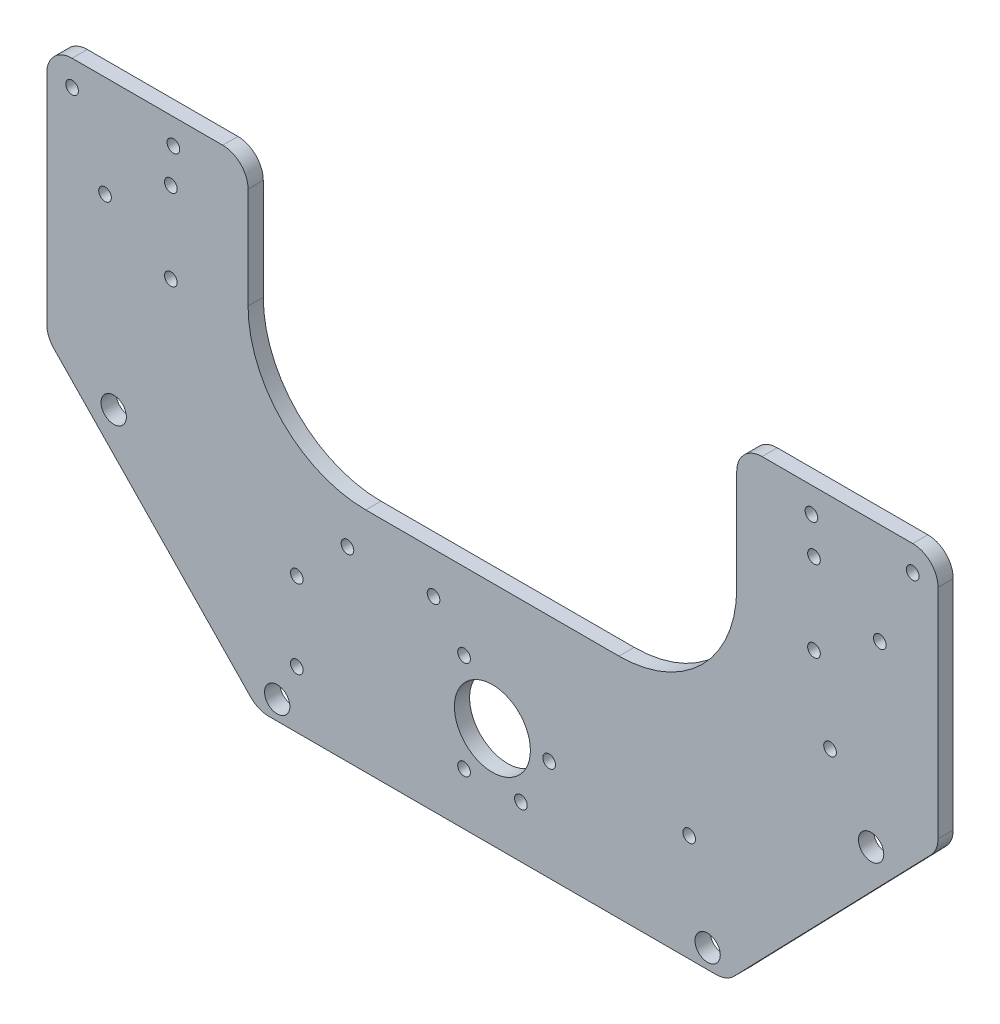
from build123d import *

# Parameters (mm, degrees)
BASE_DEPTH                    = 6
ESQUISSE10_R                  = 2.5
STEP_DEPTH                    = 223.656826754
ESQUISSE11_R                  = 15
ESQUISSE11_R_2                = 2.5
ENL_V_MAT_EXTRU_4_DEPTH       = 223.656826754
ESQUISSE12_R                  = 2.5
ENL_V_MAT_EXTRU_5_DEPTH       = 223.656826754
ESQUISSE14_R                  = 2.5
ENL_V_MAT_EXTRU_6_DEPTH       = 223.656826754
ESQUISSE15_R                  = 2.5
ENL_V_MAT_EXTRU_7_DEPTH       = 223.656826754
CONG_1_R                      = 10
SYM_TRIE4_DEPTH               = 6
ENL_V_MAT_EXTRU_13_DEPTH      = 223.656826754
ENL_V_MAT_EXTRU_13_DEPTH_BACK = 10
ESQUISSE16_R                  = 5


# Read off the part's stored shape, not the designer's step: Symétrie4
with BuildPart() as part:
    # Esquisse4 → Base (new body)
    with BuildSketch(Plane.XY):
        with BuildLine():
            Line((-176, 50), (-176, -50))
            Line((-176, -50), (-92.56776702, -136.25))
            Line((-92.56776702, -136.25), (92.56776702, -136.25))
            Line((92.56776702, -136.25), (176, -50))
            Line((176, -50), (176, 50))
            Line((176, 50), (96.5, 50))
            Line((96.5, 50), (96.5, 0))
            ThreePointArc((96.5, 0), (82.880465325, -32.880465325), (50, -46.5))
            Line((50, -46.5), (-50, -46.5))
            ThreePointArc((-50, -46.5), (-82.880465325, -32.880465325), (-96.5, 0))
            Line((-96.5, 0), (-96.5, 50))
            Line((-96.5, 50), (-176, 50))
        make_face()
    extrude(amount=BASE_DEPTH)

    # Esquisse10 → Step (cut, through all)
    with BuildSketch(Plane.XY):
        with Locations((-127, 26)):
            Circle(ESQUISSE10_R)
        with Locations((-153, 10)):
            Circle(ESQUISSE10_R)
        with Locations((-127, -6)):
            Circle(ESQUISSE10_R)
    step = extrude(amount=STEP_DEPTH, mode=Mode.SUBTRACT)

    # Step2: Step across plane
    add(step.mirror(Plane(origin=(0, 0, 0), x_dir=(0, 0, 1), z_dir=(1, 0, 0))), mode=Mode.SUBTRACT)

    # Esquisse11 → Enlèv. mat.-Extru.4 (cut, through all)
    with BuildSketch(Plane.XY):
        with Locations((0, -96.25)):
            Circle(ESQUISSE11_R)
        with Locations((-11.200595222, -76.85)):
            Circle(ESQUISSE11_R_2)
        with Locations((-11.200595222, -115.65)):
            Circle(ESQUISSE11_R_2)
        with Locations((22.401190445, -96.25)):
            Circle(ESQUISSE11_R_2)
    extrude(amount=ENL_V_MAT_EXTRU_4_DEPTH, mode=Mode.SUBTRACT)

    # Esquisse12 → Enlèv. mat.-Extru.5 (cut, through all)
    with BuildSketch(Plane.XY.offset(6)):
        with Locations((-77.25, -113.75)):
            Circle(ESQUISSE12_R)
        with Locations((-77.25, -82.75)):
            Circle(ESQUISSE12_R)
        with Locations((-57.25, -62.75)):
            Circle(ESQUISSE12_R)
        with Locations((-23.25, -62.75)):
            Circle(ESQUISSE12_R)
        with Locations((11.25, -115.75)):
            Circle(ESQUISSE12_R)
    extrude(amount=-ENL_V_MAT_EXTRU_5_DEPTH, mode=Mode.SUBTRACT)

    # Esquisse14 → Enlèv. mat.-Extru.6 (cut, through all)
    with BuildSketch(Plane.XY):
        with Locations((77.723139183, -94.064255673)):
            Circle(ESQUISSE14_R)
        with Locations((133.344627837, -36.564255673)):
            Circle(ESQUISSE14_R)
    extrude(amount=ENL_V_MAT_EXTRU_6_DEPTH, mode=Mode.SUBTRACT)

    # Esquisse15 → Enlèv. mat.-Extru.7 (cut, through all)
    with BuildSketch(Plane.XY.offset(6)):
        with Locations((-166, 40)):
            Circle(ESQUISSE15_R)
        with Locations((-126, 40)):
            Circle(ESQUISSE15_R)
        with Locations((126, 40)):
            Circle(ESQUISSE15_R)
        with Locations((166, 40)):
            Circle(ESQUISSE15_R)
    extrude(amount=-ENL_V_MAT_EXTRU_7_DEPTH, mode=Mode.SUBTRACT)

    # Congé1
    cong_1_edges = [part.edges().sort_by_distance(p)[0] for p in [
        (-96.5, 50, 3),
        (-92.56776702, -136.25, 3),
        (-176, -50, 3),
        (-176, 50, 3),
    ]]
    fillet(cong_1_edges, radius=CONG_1_R)

    # Symétrie4 outline → Symétrie4 (cut)
    with BuildSketch(Plane.XY):
        with BuildLine():
            Line((176, -50), (176, -45.954800825))
            ThreePointArc((176, -45.954800825), (175.270248109, -49.704800825), (173.1875, -52.907486907))
            Line((173.1875, -52.907486907), (176, -50))
        make_face()
        with BuildLine():
            ThreePointArc((96.5, 40), (99.428932188, 47.071067812), (106.5, 50))
            Line((106.5, 50), (96.5, 50))
            Line((96.5, 50), (96.5, 40))
        make_face()
        with BuildLine():
            ThreePointArc((166, 50), (173.071067812, 47.071067812), (176, 40))
            Line((176, 40), (176, 50))
            Line((176, 50), (166, 50))
        make_face()
        with BuildLine():
            Line((92.56776702, -136.25), (95.515525916, -133.202686082))
            ThreePointArc((95.515525916, -133.202686082), (92.231430788, -135.456705731), (88.328025916, -136.25))
            Line((88.328025916, -136.25), (92.56776702, -136.25))
        make_face()
    extrude(amount=SYM_TRIE4_DEPTH, mode=Mode.SUBTRACT)

    # Esquisse16 → Enlèv. mat.-Extru.13 (cut, two sides: drawn at the far end of the back side and taken through both)
    with BuildSketch(Plane.XY.offset(-ENL_V_MAT_EXTRU_13_DEPTH_BACK)):
        with Locations(Location((-85, -128.75, 0), (0, 0, 180))):
            Circle(ESQUISSE16_R)
        with Locations(Location((85, -128.75, 0), (0, 0, 180))):
            Circle(ESQUISSE16_R)
        with Locations(Location((-149.56929335, -62, 0), (0, 0, 180))):
            Circle(ESQUISSE16_R)
        with Locations(Location((149.56929335, -62, 0), (0, 0, 180))):
            Circle(ESQUISSE16_R)
    extrude(amount=ENL_V_MAT_EXTRU_13_DEPTH + ENL_V_MAT_EXTRU_13_DEPTH_BACK, mode=Mode.SUBTRACT)


solid = part.part
